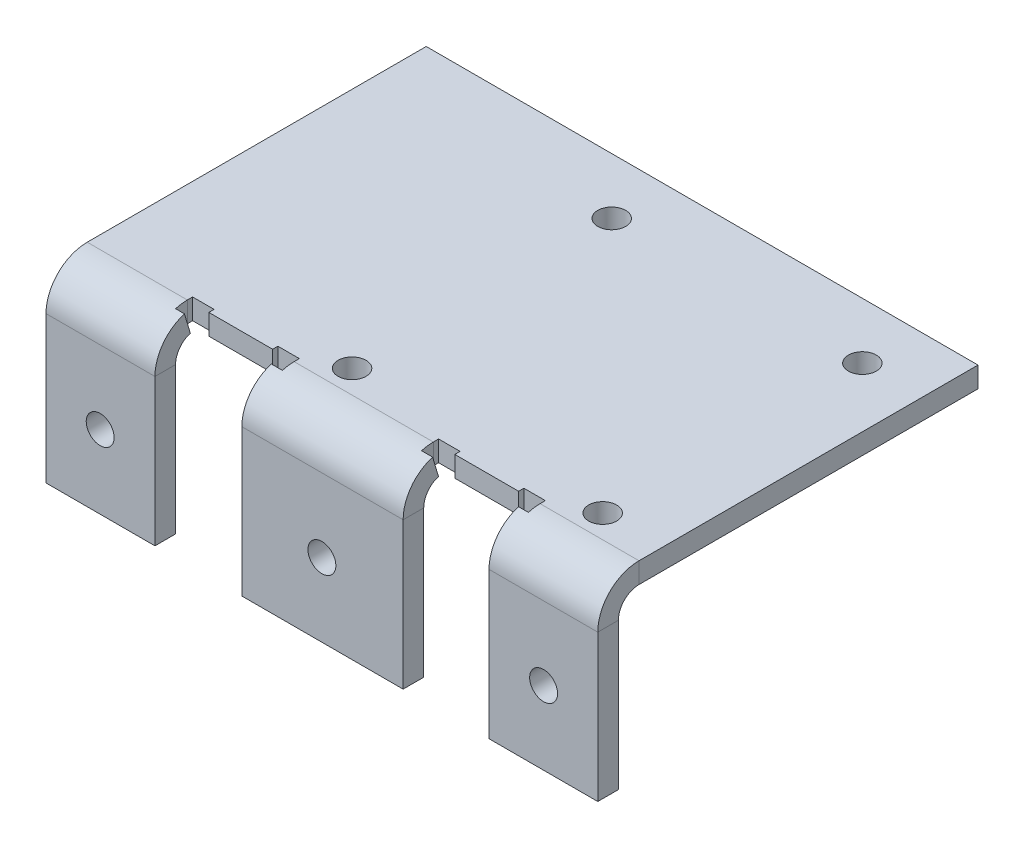
from build123d import *

# Parameters (mm, degrees)
BASE_FLANGE1_DEPTH           = 3.175
SKETCH7_R                    = 2.15
CUT_EXTRUDE1_DEPTH           = 10
CUT_EXTRUDE2_DEPTH           = 10
SKETCHED_START               = 19.282254495
SKETCHED_BEND9_OUTLINE_W     = 16.753945323
SKETCHED_BEND9_OUTLINE_H     = 3.175
SKETCHED_BEND9_OUTLINE_W_2   = 24.844698194
SKETCHED_BEND9_OUTLINE_W_3   = 16.78397474
SKETCHED_BEND9_DEPTH         = 24.098637012
SKETCHED_START_2             = 19.005571507
SKETCHED_BEND9_2_OUTLINE_W   = 21.444377118
SKETCHED_BEND9_2_OUTLINE_H   = 3.175
SKETCHED_BEND9_2_DEPTH       = 0.294970988
SKETCHED_START_3             = 13.602941495
SKETCHED_BEND9_3_OUTLINE_R   = 2.15
SKETCHED_BEND9_3_DEPTH       = 6.35
SKETCHED_START_4             = 14.505297696
SKETCHED_BEND9_4_OUTLINE_W   = 1.51683744
SKETCHED_BEND9_4_OUTLINE_H   = 3.175
SKETCHED_BEND9_4_OUTLINE_W_2 = 1.700160538
SKETCHED_BEND9_4_OUTLINE_W_3 = 1.362827281
SKETCHED_BEND9_4_DEPTH       = 0.415197651
SKETCHED_START_5             = 17.361749674
SKETCHED_BEND9_5_DEPTH       = 85
SKETCHED_START_6             = 70.675958021
SKETCHED_BEND9_6_DEPTH       = 16.44868377
SKETCHED_START_7             = 32.782897133
SKETCHED_BEND9_7_DEPTH       = 16.44868377
SKETCHED_START_8             = 49.231580903
SKETCHED_BEND9_8_DEPTH       = 21.444377118


with BuildPart() as part:
    # Base-Flange1: sheet metal written as solids
    # Sketch2 → Base-Flange1 (new body)
    with BuildSketch(Plane(origin=(0, 0, 0), x_dir=(1, 0, 0), z_dir=(0, 1, 0))):
        Polygon((17.361749674, -43.380891507), (102.361749674, -43.380891507), (102.361749674, -20.784622302), (102.361749674, -13.602941495), (102.361749674, 38.619108493), (17.361749674, 38.619108493), align=None)
    extrude(amount=-BASE_FLANGE1_DEPTH)

    # Sketch7 → Cut-Extrude1 (cut)
    with BuildSketch(Plane(origin=(0, 0, 0), x_dir=(1, 0, 0), z_dir=(0, 1, 0))):
        with Locations(Location((54.586454374, -10.030408526, 0), (0, 0, 270))):
            Circle(SKETCH7_R)
        with Locations(Location((93.192772434, -10.030408526, 0), (0, 0, 270))):
            Circle(SKETCH7_R)
        with Locations(Location((93.192772434, 29.969592019, 0), (0, 0, 270))):
            Circle(SKETCH7_R)
        with Locations(Location((54.586454374, 29.969592019, 0), (0, 0, 270))):
            Circle(SKETCH7_R)
        with Locations(Location((94.016482215, -32.082756904, 0), (0, 0, 270))):
            Circle(SKETCH7_R)
        with Locations(Location((59.861749674, -32.082756904, 0), (0, 0, 270))):
            Circle(SKETCH7_R)
        with Locations(Location((25.707017133, -32.082756904, 0), (0, 0, 270))):
            Circle(SKETCH7_R)
    extrude(amount=-CUT_EXTRUDE1_DEPTH, mode=Mode.SUBTRACT)

    # Sketch8 → Cut-Extrude2 (cut)
    with BuildSketch(Plane(origin=(0, 0, 0), x_dir=(1, 0, 0), z_dir=(0, 1, 0))):
        Polygon((85.607804351, -43.380891507), (72.376118559, -43.380891507), (72.376118559, -14.920495347), (70.675958021, -14.920495347), (70.675958021, -12.791720969), (73.98738483, -12.791720969), (73.98738483, -13.602941495), (83.813214982, -13.602941495), (83.813214982, -12.791720969), (87.124641791, -12.791720969), (87.124641791, -14.920495347), (85.607804351, -14.920495347), align=None)
        Polygon((47.531420365, -43.380891507), (34.145724414, -43.380891507), (34.145724414, -14.920495347), (32.782897133, -14.920495347), (32.782897133, -12.791720969), (36.094323942, -12.791720969), (36.094323942, -13.602941495), (45.920154094, -13.602941495), (45.920154094, -12.791720969), (49.231580903, -12.791720969), (49.231580903, -14.920495347), (47.531420365, -14.920495347), align=None)
    extrude(amount=-CUT_EXTRUDE2_DEPTH, mode=Mode.SUBTRACT)

    # Sketched Bend9: read off the stored shape, not the designer's step
    # Sketched Bend9 outline → Sketched Bend9 (cut)
    with BuildSketch(Plane.XY.offset(SKETCHED_START)):
        with Locations((93.984777013, -1.5875)):
            Rectangle(SKETCHED_BEND9_OUTLINE_W, SKETCHED_BEND9_OUTLINE_H)
        with Locations((59.953769462, -1.5875)):
            Rectangle(SKETCHED_BEND9_OUTLINE_W_2, SKETCHED_BEND9_OUTLINE_H)
        with Locations((25.753737044, -1.5875)):
            Rectangle(SKETCHED_BEND9_OUTLINE_W_3, SKETCHED_BEND9_OUTLINE_H)
    extrude(amount=SKETCHED_BEND9_DEPTH, mode=Mode.SUBTRACT)

    # Sketched Bend9 2 outline → Sketched Bend9 2 (cut)
    with BuildSketch(Plane.XY.offset(SKETCHED_START_2)):
        with Locations((59.953769462, -1.5875)):
            Rectangle(SKETCHED_BEND9_2_OUTLINE_W, SKETCHED_BEND9_2_OUTLINE_H)
    extrude(amount=SKETCHED_BEND9_2_DEPTH, mode=Mode.SUBTRACT)

    # Sketched Bend9 3 outline → Sketched Bend9 3 (add)
    # profile 1 of 3: a face of its own
    with BuildSketch(Plane.XY.offset(SKETCHED_START_3)):
        Polygon((85.607804351, -28.946269205), (102.361749674, -28.946269205), (102.361749674, -3.175), (87.124641791, -3.175), (85.607804351, -3.175), align=None)
        with Locations((94.016482215, -17.648134603)):
            Circle(SKETCHED_BEND9_3_OUTLINE_R, mode=Mode.SUBTRACT)
    # profile 2 of 3: a face of its own
    with BuildSketch(Plane.XY.offset(SKETCHED_START_3)):
        Polygon((72.376118559, -28.946269205), (72.376118559, -3.175), (70.675958021, -3.175), (49.231580903, -3.175), (47.531420365, -3.175), (47.531420365, -28.946269205), align=None)
        with Locations((59.861749674, -17.648134603)):
            Circle(SKETCHED_BEND9_3_OUTLINE_R, mode=Mode.SUBTRACT)
    # profile 3 of 3: a face of its own
    with BuildSketch(Plane.XY.offset(SKETCHED_START_3)):
        Polygon((34.145724414, -28.946269205), (34.145724414, -3.175), (32.782897133, -3.175), (17.361749674, -3.175), (17.361749674, -28.946269205), align=None)
        with Locations((25.707017133, -17.648134603)):
            Circle(SKETCHED_BEND9_3_OUTLINE_R, mode=Mode.SUBTRACT)
    extrude(amount=SKETCHED_BEND9_3_DEPTH)

    # Sketched Bend9 4 outline → Sketched Bend9 4 (add)
    with BuildSketch(Plane.XY.offset(SKETCHED_START_4)):
        with Locations((86.366223071, -1.5875)):
            Rectangle(SKETCHED_BEND9_4_OUTLINE_W, SKETCHED_BEND9_4_OUTLINE_H)
        with Locations((71.52603829, -1.5875)):
            Rectangle(SKETCHED_BEND9_4_OUTLINE_W_2, SKETCHED_BEND9_4_OUTLINE_H)
        with Locations((48.381500634, -1.5875)):
            Rectangle(SKETCHED_BEND9_4_OUTLINE_W_2, SKETCHED_BEND9_4_OUTLINE_H)
        with Locations((33.464310774, -1.5875)):
            Rectangle(SKETCHED_BEND9_4_OUTLINE_W_3, SKETCHED_BEND9_4_OUTLINE_H)
    extrude(amount=SKETCHED_BEND9_4_DEPTH)

    # Sketched Bend9 5 outline → Sketched Bend9 5 (cut)
    with BuildSketch(Plane.YZ.offset(SKETCHED_START_5)):
        with BuildLine():
            ThreePointArc((-3.175, 13.602941495), (-4.10493597, 15.848005525), (-6.35, 16.777941495))
            Line((-6.35, 16.777941495), (-28.946269205, 16.777941495))
            Line((-28.946269205, 16.777941495), (-28.946269205, 13.602941495))
            Line((-28.946269205, 13.602941495), (-3.175, 13.602941495))
        make_face()
        with BuildLine():
            Line((0, 13.602941495), (0, 19.282254495))
            Line((0, 19.282254495), (-3.175, 19.282254495))
            Line((-3.175, 19.282254495), (-3.175, 19.952941495))
            Line((-3.175, 19.952941495), (-6.35, 19.952941495))
            ThreePointArc((-6.35, 19.952941495), (-1.859871939, 18.093069556), (0, 13.602941495))
        make_face()
    extrude(amount=SKETCHED_BEND9_5_DEPTH, mode=Mode.SUBTRACT)

    # Sketched Bend9 6 outline → Sketched Bend9 6 (cut)
    with BuildSketch(Plane.YZ.offset(SKETCHED_START_6)):
        with BuildLine():
            Line((-0.261854704, 15.407653897), (-3.305927352, 14.505297696))
            ThreePointArc((-3.305927352, 14.505297696), (-3.20790232, 14.058844085), (-3.175, 13.602941495))
            Line((-3.175, 13.602941495), (-3.175, 14.505297696))
            Line((-3.175, 14.505297696), (-0.064440893, 14.505297696))
            ThreePointArc((-0.064440893, 14.505297696), (-0.146718462, 14.96007014), (-0.261854704, 15.407653897))
        make_face()
    extrude(amount=SKETCHED_BEND9_6_DEPTH, mode=Mode.SUBTRACT)

    # Sketched Bend9 7 outline → Sketched Bend9 7 (cut)
    with BuildSketch(Plane.YZ.offset(SKETCHED_START_7)):
        with BuildLine():
            Line((-0.261854704, 15.407653897), (-3.305927352, 14.505297696))
            ThreePointArc((-3.305927352, 14.505297696), (-3.20790232, 14.058844085), (-3.175, 13.602941495))
            Line((-3.175, 13.602941495), (-3.175, 14.505297696))
            Line((-3.175, 14.505297696), (-0.064440893, 14.505297696))
            ThreePointArc((-0.064440893, 14.505297696), (-0.146718462, 14.96007014), (-0.261854704, 15.407653897))
        make_face()
    extrude(amount=SKETCHED_BEND9_7_DEPTH, mode=Mode.SUBTRACT)

    # Sketched Bend9 8 outline → Sketched Bend9 8 (add)
    with BuildSketch(Plane.YZ.offset(SKETCHED_START_8)):
        with BuildLine():
            Line((-3.175, 19.005571507), (-3.013221769, 19.005571507))
            ThreePointArc((-3.013221769, 19.005571507), (-3.093752415, 19.054487301), (-3.175, 19.10220281))
            Line((-3.175, 19.10220281), (-3.175, 19.005571507))
        make_face()
    extrude(amount=SKETCHED_BEND9_8_DEPTH)


solid = part.part
